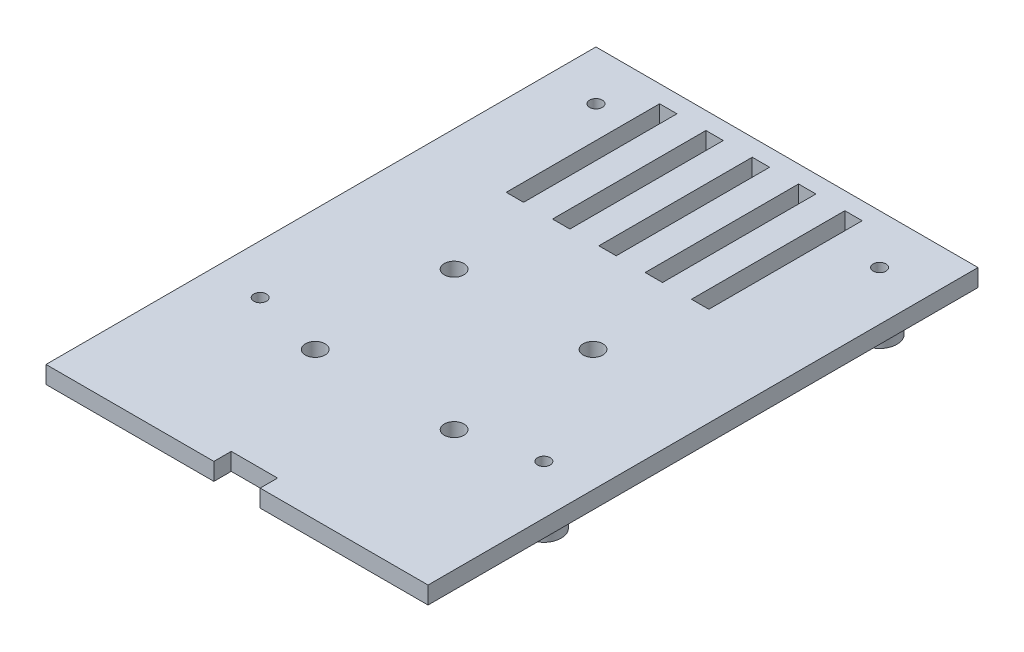
from build123d import *

# Parameters (mm, degrees)
SKETCH1_W                       = 66
SKETCH1_H                       = 95
CRADLE_BASE_DEPTH               = 3
SKETCH2_R                       = 3
STANDOFFS_DEPTH                 = 10
PILOT_AND_BOLT_HOLES_DEPTH      = 144.412865532
PILOT_AND_BOLT_HOLES_DEPTH_BACK = 144.412865532
SKETCH3_R                       = 1.1
SKETCH3_R_2                     = 1.7
VENT_SLOTS_DEPTH                = 144.412865532
VENT_SLOTS_DEPTH_BACK           = 144.412865532
SKETCH4_W                       = 3
SKETCH4_H                       = 26.5
USB_END_NOTCH_DEPTH             = 144.412865532
USB_END_NOTCH_DEPTH_BACK        = 144.412865532
SKETCH5_W                       = 8
SKETCH5_H                       = 4


with BuildPart() as part:
    # Sketch1 → Cradle Base (new body)
    with BuildSketch(Plane(origin=(0, 0, 0), x_dir=(1, 0, 0), z_dir=(0, 1, 0))):
        with Locations((-98, 10)):
            Rectangle(SKETCH1_W, SKETCH1_H)
    extrude(amount=-CRADLE_BASE_DEPTH)

    # Sketch2 → Standoffs (add)
    with BuildSketch(Plane(origin=(0, 0, 0), x_dir=(1, 0, 0), z_dir=(0, 1, 0))):
        with Locations((-122.5, 49)):
            Circle(SKETCH2_R)
        with Locations((-122.5, -9)):
            Circle(SKETCH2_R)
        with Locations((-73.5, 49)):
            Circle(SKETCH2_R)
        with Locations((-73.5, -9)):
            Circle(SKETCH2_R)
    extrude(amount=-STANDOFFS_DEPTH)

    # Sketch3 → Pilot and Bolt Holes (cut, two sides: drawn at the far end of the back side and taken through both)
    with BuildSketch(Plane(origin=(0, 0, 0), x_dir=(1, 0, 0), z_dir=(0, 1, 0)).offset(-PILOT_AND_BOLT_HOLES_DEPTH_BACK)):
        with Locations((-122.5, 49)):
            Circle(SKETCH3_R)
        with Locations((-122.5, -9)):
            Circle(SKETCH3_R)
        with Locations((-73.5, 49)):
            Circle(SKETCH3_R)
        with Locations((-73.5, -9)):
            Circle(SKETCH3_R)
        with Locations((-110, -12)):
            Circle(SKETCH3_R_2)
        with Locations((-110, 12)):
            Circle(SKETCH3_R_2)
        with Locations((-86, -12)):
            Circle(SKETCH3_R_2)
        with Locations((-86, 12)):
            Circle(SKETCH3_R_2)
    extrude(amount=PILOT_AND_BOLT_HOLES_DEPTH + PILOT_AND_BOLT_HOLES_DEPTH_BACK, mode=Mode.SUBTRACT)

    # Sketch4 → Vent Slots (cut, two sides: drawn at the far end of the back side and taken through both)
    with BuildSketch(Plane(origin=(0, 0, 0), x_dir=(1, 0, 0), z_dir=(0, 1, 0)).offset(-VENT_SLOTS_DEPTH_BACK)):
        with Locations((-83.5, 41.25)):
            Rectangle(SKETCH4_W, SKETCH4_H)
        with Locations((-91.5, 41.25)):
            Rectangle(SKETCH4_W, SKETCH4_H)
        with Locations((-99.5, 41.25)):
            Rectangle(SKETCH4_W, SKETCH4_H)
        with Locations((-107.5, 41.25)):
            Rectangle(SKETCH4_W, SKETCH4_H)
        with Locations((-115.5, 41.25)):
            Rectangle(SKETCH4_W, SKETCH4_H)
    extrude(amount=VENT_SLOTS_DEPTH + VENT_SLOTS_DEPTH_BACK, mode=Mode.SUBTRACT)

    # Sketch5 → USB End Notch (cut, two sides: drawn at the far end of the back side and taken through both)
    with BuildSketch(Plane(origin=(0, 0, 0), x_dir=(1, 0, 0), z_dir=(0, 1, 0)).offset(-USB_END_NOTCH_DEPTH_BACK)):
        with Locations((-98, -36.5)):
            Rectangle(SKETCH5_W, SKETCH5_H)
    extrude(amount=USB_END_NOTCH_DEPTH + USB_END_NOTCH_DEPTH_BACK, mode=Mode.SUBTRACT)


solid = part.part
